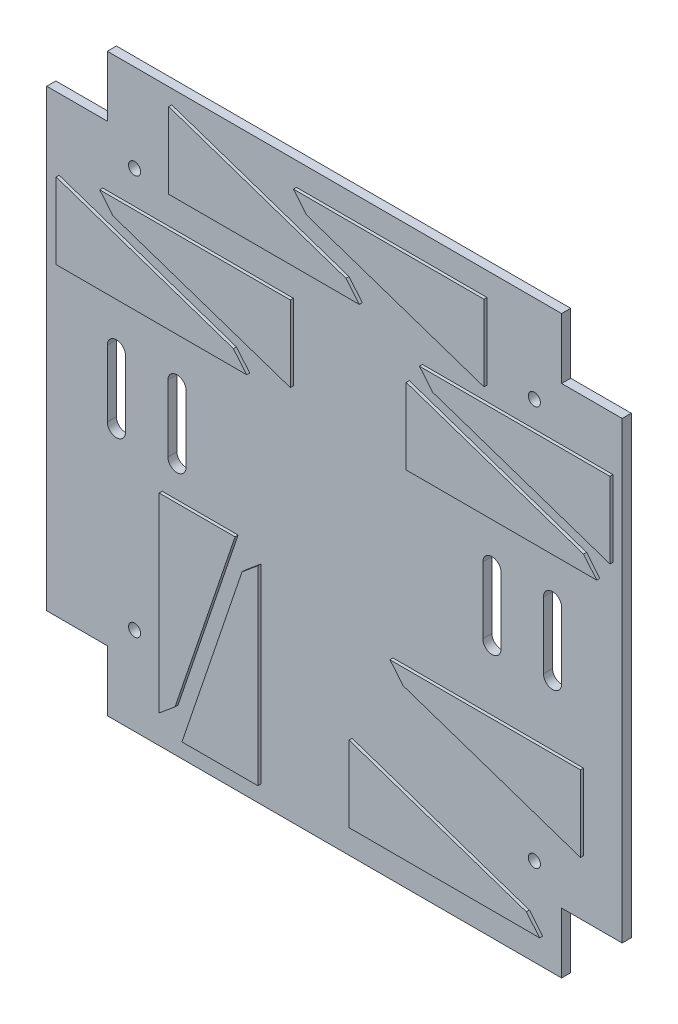
from build123d import *

# Parameters (mm, degrees)
BOSS_EXTRUDE3_DEPTH     = 2
BOSS_EXTRUDE3_2_DEPTH   = 2
BOSS_EXTRUDE3_3_DEPTH   = 2
BOSS_EXTRUDE3_4_DEPTH   = 2
BOSS_EXTRUDE3_5_DEPTH   = 2
BOSS_EXTRUDE3_6_DEPTH   = 2
BOSS_EXTRUDE3_7_DEPTH   = 2
BOSS_EXTRUDE3_8_DEPTH   = 2
BOSS_EXTRUDE3_9_DEPTH   = 2
BOSS_EXTRUDE3_10_DEPTH  = 2
BOSS_EXTRUDE4_OUTLINE_R = 1
BOSS_EXTRUDE4_DEPTH     = 1.5


# Read off the part's stored shape, not the designer's step: Boss-Extrude4
with BuildPart() as part:
    # Model → Boss-Extrude3 (new body)
    with BuildSketch(Plane.XY):
        Polygon((59.84570046, 60.330296093), (59.8457, 60.3111), (59.8457, 60.3027), (59.8613, 60.3027), (59.876264405, 60.302691244), (91.309, 60.2843), (89.13842206, 62.894165109), (89.1181, 62.9186), (89.088037471, 62.928783041), (59.846, 72.8339), align=None)
    extrude(amount=BOSS_EXTRUDE3_DEPTH)



with BuildPart() as body_2:
    # Model → Boss-Extrude3 2 (new body)
    with BuildSketch(Plane.XY):
        Polygon((93.49429954, 76.189703907), (93.4943, 76.2089), (93.4943, 76.2173), (93.4787, 76.2173), (93.463735595, 76.217308756), (62.031, 76.2357), (64.20157794, 73.625834891), (64.2219, 73.6014), (64.251962529, 73.591216959), (93.494, 63.6861), align=None)
    extrude(amount=BOSS_EXTRUDE3_2_DEPTH)


with BuildPart() as body_3:
    # Model → Boss-Extrude3 3 (new body)
    with BuildSketch(Plane.XY):
        Polygon((72.68429954, 91.109703907), (72.6843, 91.1289), (72.6843, 91.1373), (72.6687, 91.1373), (72.653735595, 91.137308756), (41.221, 91.1557), (43.39157794, 88.545834891), (43.4119, 88.5214), (43.441962529, 88.511216959), (72.684, 78.6061), align=None)
    extrude(amount=BOSS_EXTRUDE3_3_DEPTH)


with BuildPart() as body_4:
    # Model → Boss-Extrude3 4 (new body)
    with BuildSketch(Plane.XY):
        Polygon((20.63570046, 80.150296093), (20.6357, 80.1311), (20.6357, 80.1227), (20.6513, 80.1227), (20.666264405, 80.122691244), (52.099, 80.1043), (49.92842206, 82.714165109), (49.9081, 82.7386), (49.878037471, 82.748783041), (20.636, 92.6539), align=None)
    extrude(amount=BOSS_EXTRUDE3_4_DEPTH)


with BuildPart() as body_5:
    # Model → Boss-Extrude3 5 (new body)
    with BuildSketch(Plane.XY):
        Polygon((40.7143, 75.0473), (40.6987, 75.0473), (40.683735595, 75.047308756), (9.251, 75.0657), (11.42157794, 72.455834891), (11.4419, 72.4314), (11.471962529, 72.421216959), (40.714, 62.5161), (40.71429954, 75.019703907), (40.7143, 75.0389), align=None)
    extrude(amount=BOSS_EXTRUDE3_5_DEPTH)


with BuildPart() as body_6:
    # Model → Boss-Extrude3 6 (new body)
    with BuildSketch(Plane.XY):
        Polygon((2.04570046, 60.800296093), (2.0457, 60.7811), (2.0457, 60.7727), (2.0613, 60.7727), (2.076264405, 60.772691244), (33.509, 60.7543), (31.33842206, 63.364165109), (31.3181, 63.3886), (31.288037471, 63.398783041), (2.046, 73.3039), align=None)
    extrude(amount=BOSS_EXTRUDE3_6_DEPTH)


with BuildPart() as body_7:
    # Model → Boss-Extrude3 7 (new body)
    with BuildSketch(Plane.XY):
        Polygon((19.090296093, 36.62429954), (19.0711, 36.6243), (19.0627, 36.6243), (19.0627, 36.6087), (19.062691244, 36.593735595), (19.0443, 5.161), (21.654165109, 7.33157794), (21.6786, 7.3519), (21.688783041, 7.381962529), (31.5939, 36.624), align=None)
    extrude(amount=BOSS_EXTRUDE3_7_DEPTH)


with BuildPart() as body_8:
    # Model → Boss-Extrude3 8 (new body)
    with BuildSketch(Plane.XY):
        Polygon((35.3573, 2.9157), (35.3573, 2.9313), (35.357308756, 2.946264405), (35.3757, 34.379), (32.765834891, 32.20842206), (32.7414, 32.1881), (32.731216959, 32.158037471), (22.8261, 2.916), (35.329703907, 2.91570046), (35.3489, 2.9157), align=None)
    extrude(amount=BOSS_EXTRUDE3_8_DEPTH)


with BuildPart() as body_9:
    # Model → Boss-Extrude3 9 (new body)
    with BuildSketch(Plane.XY):
        Polygon((50.41570046, 4.470296093), (50.4157, 4.4511), (50.4157, 4.4427), (50.4313, 4.4427), (50.446264405, 4.442691244), (81.879, 4.4243), (79.70842206, 7.034165109), (79.6881, 7.0586), (79.658037471, 7.068783041), (50.416, 16.9739), align=None)
    extrude(amount=BOSS_EXTRUDE3_9_DEPTH)


with BuildPart() as body_10:
    # Model → Boss-Extrude3 10 (new body)
    with BuildSketch(Plane.XY):
        Polygon((88.62429954, 31.789703907), (88.6243, 31.8089), (88.6243, 31.8173), (88.6087, 31.8173), (88.593735595, 31.817308756), (57.161, 31.8357), (59.33157794, 29.225834891), (59.3519, 29.2014), (59.381962529, 29.191216959), (88.624, 19.2861), align=None)
    extrude(amount=BOSS_EXTRUDE3_10_DEPTH)


with BuildPart() as part_1:
    add(part.part)

    add(body_2.part)  # Boss-Extrude4 merges body 2

    add(body_3.part)  # Boss-Extrude4 merges body 3

    add(body_4.part)  # Boss-Extrude4 merges body 4

    add(body_5.part)  # Boss-Extrude4 merges body 5

    add(body_6.part)  # Boss-Extrude4 merges body 6

    add(body_7.part)  # Boss-Extrude4 merges body 7

    add(body_8.part)  # Boss-Extrude4 merges body 8

    add(body_9.part)  # Boss-Extrude4 merges body 9

    add(body_10.part)  # Boss-Extrude4 merges body 10
    # Boss-Extrude4 outline → Boss-Extrude4 (add)
    with BuildSketch(Plane.XY):
        Polygon((10, 85), (0, 85), (0, 10), (10, 10), (10, 0), (85, 0), (85, 10), (95, 10), (95, 85), (85, 85), (85, 95), (10, 95), align=None)
        with Locations((14.5, 14.5)):
            Circle(BOSS_EXTRUDE4_OUTLINE_R, mode=Mode.SUBTRACT)
        with BuildLine():
            Line((35.3757, 34.379), (35.357308756, 2.946264405))
            ThreePointArc((35.357308756, 2.946264405), (35.375994273, 2.93215571), (35.379898885, 2.909069831))
            ThreePointArc((35.379898885, 2.909069831), (35.353148575, 2.899873011), (35.329703907, 2.91570046))
            Line((35.329703907, 2.91570046), (22.8261, 2.916))
            Line((22.8261, 2.916), (32.7414, 32.1881))
            Line((32.7414, 32.1881), (35.3757, 34.379))
        make_face(mode=Mode.SUBTRACT)
        with BuildLine():
            Line((19.0443, 5.161), (19.062691244, 36.593735595))
            ThreePointArc((19.062691244, 36.593735595), (19.044005727, 36.60784429), (19.040101115, 36.630930169))
            ThreePointArc((19.040101115, 36.630930169), (19.066851425, 36.640126989), (19.090296093, 36.62429954))
            Line((19.090296093, 36.62429954), (31.5939, 36.624))
            Line((31.5939, 36.624), (21.6786, 7.3519))
            Line((21.6786, 7.3519), (19.0443, 5.161))
        make_face(mode=Mode.SUBTRACT)
        with BuildLine():
            Line((81.879, 4.4243), (50.446264405, 4.442691244))
            ThreePointArc((50.446264405, 4.442691244), (50.43215571, 4.424005727), (50.409069831, 4.420101115))
            ThreePointArc((50.409069831, 4.420101115), (50.399873011, 4.446851425), (50.41570046, 4.470296093))
            Line((50.41570046, 4.470296093), (50.416, 16.9739))
            Line((50.416, 16.9739), (79.6881, 7.0586))
            Line((79.6881, 7.0586), (81.879, 4.4243))
        make_face(mode=Mode.SUBTRACT)
        with Locations((80.5, 14.5)):
            Circle(BOSS_EXTRUDE4_OUTLINE_R, mode=Mode.SUBTRACT)
        with BuildLine():
            Line((57.161, 31.8357), (88.593735595, 31.817308756))
            ThreePointArc((88.593735595, 31.817308756), (88.60784429, 31.835994273), (88.630930169, 31.839898885))
            ThreePointArc((88.630930169, 31.839898885), (88.640126989, 31.813148575), (88.62429954, 31.789703907))
            Line((88.62429954, 31.789703907), (88.624, 19.2861))
            Line((88.624, 19.2861), (59.3519, 29.2014))
            Line((59.3519, 29.2014), (57.161, 31.8357))
        make_face(mode=Mode.SUBTRACT)
        with BuildLine():
            Line((10, 42), (10, 53))
            ThreePointArc((10, 53), (11.5, 54.5), (13, 53))
            Line((13, 53), (13, 42))
            ThreePointArc((13, 42), (11.5, 40.5), (10, 42))
        make_face(mode=Mode.SUBTRACT)
        with BuildLine():
            Line((20, 42), (20, 53))
            ThreePointArc((20, 53), (21.5, 54.5), (23, 53))
            Line((23, 53), (23, 42))
            ThreePointArc((23, 42), (21.5, 40.5), (20, 42))
        make_face(mode=Mode.SUBTRACT)
        with BuildLine():
            Line((33.509, 60.7543), (2.076264405, 60.772691244))
            ThreePointArc((2.076264405, 60.772691244), (2.06215571, 60.754005727), (2.039069831, 60.750101115))
            ThreePointArc((2.039069831, 60.750101115), (2.029873011, 60.776851425), (2.04570046, 60.800296093))
            Line((2.04570046, 60.800296093), (2.046, 73.3039))
            Line((2.046, 73.3039), (31.3181, 63.3886))
            Line((31.3181, 63.3886), (33.509, 60.7543))
        make_face(mode=Mode.SUBTRACT)
        with BuildLine():
            Line((9.251, 75.0657), (40.683735595, 75.047308756))
            ThreePointArc((40.683735595, 75.047308756), (40.69784429, 75.065994273), (40.720930169, 75.069898885))
            ThreePointArc((40.720930169, 75.069898885), (40.730126989, 75.043148575), (40.71429954, 75.019703907))
            Line((40.71429954, 75.019703907), (40.714, 62.5161))
            Line((40.714, 62.5161), (11.4419, 72.4314))
            Line((11.4419, 72.4314), (9.251, 75.0657))
        make_face(mode=Mode.SUBTRACT)
        with Locations((14.5, 80.5)):
            Circle(BOSS_EXTRUDE4_OUTLINE_R, mode=Mode.SUBTRACT)
        with BuildLine():
            Line((52.099, 80.1043), (20.666264405, 80.122691244))
            ThreePointArc((20.666264405, 80.122691244), (20.65215571, 80.104005727), (20.629069831, 80.100101115))
            ThreePointArc((20.629069831, 80.100101115), (20.619873011, 80.126851425), (20.63570046, 80.150296093))
            Line((20.63570046, 80.150296093), (20.636, 92.6539))
            Line((20.636, 92.6539), (49.9081, 82.7386))
            Line((49.9081, 82.7386), (52.099, 80.1043))
        make_face(mode=Mode.SUBTRACT)
        with BuildLine():
            Line((72, 42), (72, 53))
            ThreePointArc((72, 53), (73.5, 54.5), (75, 53))
            Line((75, 53), (75, 42))
            ThreePointArc((75, 42), (73.5, 40.5), (72, 42))
        make_face(mode=Mode.SUBTRACT)
        with BuildLine():
            Line((82, 42), (82, 53))
            ThreePointArc((82, 53), (83.5, 54.5), (85, 53))
            Line((85, 53), (85, 42))
            ThreePointArc((85, 42), (83.5, 40.5), (82, 42))
        make_face(mode=Mode.SUBTRACT)
        with BuildLine():
            Line((91.309, 60.2843), (59.876264405, 60.302691244))
            ThreePointArc((59.876264405, 60.302691244), (59.86215571, 60.284005727), (59.839069831, 60.280101115))
            ThreePointArc((59.839069831, 60.280101115), (59.829873011, 60.306851425), (59.84570046, 60.330296093))
            Line((59.84570046, 60.330296093), (59.846, 72.8339))
            Line((59.846, 72.8339), (89.1181, 62.9186))
            Line((89.1181, 62.9186), (91.309, 60.2843))
        make_face(mode=Mode.SUBTRACT)
        with BuildLine():
            Line((62.031, 76.2357), (93.463735595, 76.217308756))
            ThreePointArc((93.463735595, 76.217308756), (93.47784429, 76.235994273), (93.500930169, 76.239898885))
            ThreePointArc((93.500930169, 76.239898885), (93.510126989, 76.213148575), (93.49429954, 76.189703907))
            Line((93.49429954, 76.189703907), (93.494, 63.6861))
            Line((93.494, 63.6861), (64.2219, 73.6014))
            Line((64.2219, 73.6014), (62.031, 76.2357))
        make_face(mode=Mode.SUBTRACT)
        with BuildLine():
            Line((41.221, 91.1557), (72.653735595, 91.137308756))
            ThreePointArc((72.653735595, 91.137308756), (72.66784429, 91.155994273), (72.690930169, 91.159898885))
            ThreePointArc((72.690930169, 91.159898885), (72.700126989, 91.133148575), (72.68429954, 91.109703907))
            Line((72.68429954, 91.109703907), (72.684, 78.6061))
            Line((72.684, 78.6061), (43.4119, 88.5214))
            Line((43.4119, 88.5214), (41.221, 91.1557))
        make_face(mode=Mode.SUBTRACT)
        with Locations((80.5, 80.5)):
            Circle(BOSS_EXTRUDE4_OUTLINE_R, mode=Mode.SUBTRACT)
    extrude(amount=BOSS_EXTRUDE4_DEPTH)


solid = part_1.part
